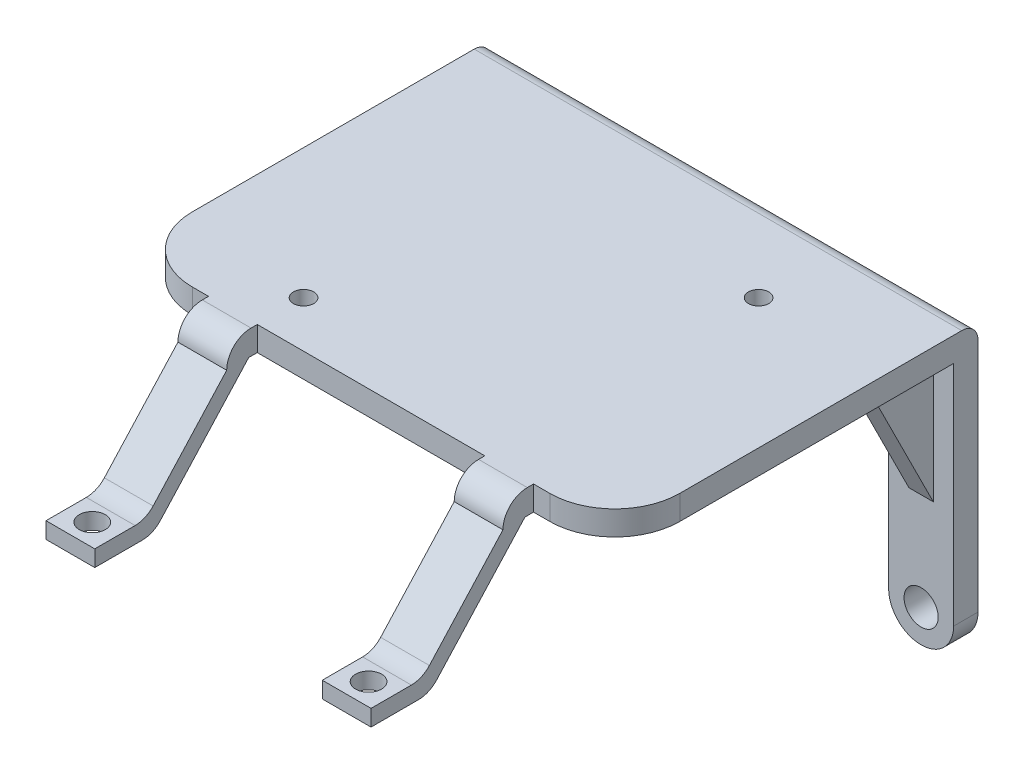
from build123d import *

# Parameters (mm, degrees)
SKETCH_1_W          = 60
SKETCH_1_H          = 50
EXTRUDE_1_DEPTH     = 3
SKETCH_2_R          = 1.25
CUT_EXTRUDE_1_DEPTH = 3
SKETCH_4_W          = 3
SKETCH_4_H          = 28
EXTRUDE_3_DEPTH     = 60
SKETCH_5_W          = 44
SKETCH_5_H          = 28
CUT_EXTRUDE_2_DEPTH = 10
EXTRUDE_4_DEPTH     = 3
SKETCH_8_R          = 2.1
CUT_EXTRUDE_3_DEPTH = 65.288412642
EXTRUDE_5_DEPTH     = 60
SKETCH_9_W          = 10
SKETCH_9_H          = 20
SKETCH_9_W_2        = 28
CUT_EXTRUDE_4_DEPTH = 54.293490307
SKETCH_11_R         = 1.6
CUT_EXTRUDE_5_DEPTH = 54.293490307
SKETCH_12_W         = 1.537741429
SKETCH_12_H         = 3
CUT_EXTRUDE_6_DEPTH = 72.413687212
FILLET_1_R          = 8
FILLET_2_R          = 8
FILLET_3_R          = 3
FILLET_4_R          = 3
FILLET_5_R          = 2
RIB_2_REACH         = 77.736
SKETCH_14_WALL_W    = 171.36018765
SKETCH_14_WALL_H    = 3
RIB_3_REACH         = 77.736
SKETCH_16_WALL_W    = 171.36018765
SKETCH_16_WALL_H    = 3
RIB_4_REACH         = 71.346
SKETCH_17_WALL_W    = 148.898052794
SKETCH_17_WALL_H    = 2
RIB_5_REACH         = 71.346
SKETCH_18_WALL_W    = 148.810340372
SKETCH_18_WALL_H    = 2


with BuildPart() as part:
    # 草图1 → 凸台-拉伸1 (new body)
    with BuildSketch(Plane(origin=(0, 0, 0), x_dir=(1, 0, 0), z_dir=(0, 1, 0))):
        Rectangle(SKETCH_1_W, SKETCH_1_H)
    extrude(amount=EXTRUDE_1_DEPTH)

    # 草图2 → 切除-拉伸1 (cut)
    with BuildSketch(Plane(origin=(0, 3, 0), x_dir=(1, 0, 0), z_dir=(0, 1, 0))):
        with Locations(Location((-14.000714267, -14.000714267, 0), (0, 0, 270))):
            Circle(SKETCH_2_R)
        with Locations(Location((14.000714267, 14.000714267, 0), (0, 0, 270))):
            Circle(SKETCH_2_R)
    extrude(amount=-CUT_EXTRUDE_1_DEPTH, mode=Mode.SUBTRACT)

    # 草图4 → 凸台-拉伸3 (add)
    with BuildSketch(Plane(origin=(30, 0, 0), x_dir=(0, 0, -1), z_dir=(1, 0, 0))):
        with Locations((23.5, -14)):
            Rectangle(SKETCH_4_W, SKETCH_4_H)
    extrude(amount=-EXTRUDE_3_DEPTH)

    # 草图5 → 切除-拉伸2 (cut)
    with BuildSketch(Plane(origin=(0, 0, -25), x_dir=(-1, 0, 0), z_dir=(0, 0, -1))):
        with Locations((0, -14)):
            Rectangle(SKETCH_5_W, SKETCH_5_H)
    extrude(amount=-CUT_EXTRUDE_2_DEPTH, mode=Mode.SUBTRACT)

    # 草图7 → 凸台-拉伸4 (add)
    with BuildSketch(Plane.XY.offset(-22)):
        with BuildLine():
            Line((-30, -28), (-22, -28))
            ThreePointArc((-22, -28), (-26, -32), (-30, -28))
        make_face()
        with BuildLine():
            Line((22, -28), (30, -28))
            ThreePointArc((30, -28), (26, -32), (22, -28))
        make_face()
    extrude(amount=-EXTRUDE_4_DEPTH)

    # 草图8 → 切除-拉伸3 (cut, through all)
    with BuildSketch(Plane.XY.offset(-22)):
        with Locations((26, -28)):
            Circle(SKETCH_8_R)
        with Locations((-26, -28)):
            Circle(SKETCH_8_R)
    extrude(amount=-CUT_EXTRUDE_3_DEPTH, mode=Mode.SUBTRACT)

    # 草图3 → 凸台-拉伸5 (add)
    with BuildSketch(Plane(origin=(30, 0, 0), x_dir=(0, 0, -1), z_dir=(1, 0, 0))):
        Polygon((-20.756443745, 0), (-32.524054991, -12.913843028), (-39.697792397, -12.913843028), (-39.697792397, -10.913843028), (-33.407389674, -10.913843028), (-23.462258571, 0), align=None)
    extrude(amount=-EXTRUDE_5_DEPTH)

    # 草图9 → 切除-拉伸4 (cut, through all)
    with BuildSketch(Plane.XZ.offset(12.913843028)):
        with Locations((25, 29.697792397)):
            Rectangle(SKETCH_9_W, SKETCH_9_H)
        with Locations((0, 29.697792397)):
            Rectangle(SKETCH_9_W_2, SKETCH_9_H)
        with Locations((-25, 29.697792397)):
            Rectangle(SKETCH_9_W, SKETCH_9_H)
    extrude(amount=-CUT_EXTRUDE_4_DEPTH, mode=Mode.SUBTRACT)

    # 草图11 → 切除-拉伸5 (cut, through all)
    with BuildSketch(Plane.XZ.offset(12.913843028)):
        with Locations(Location((17, 37, 0), (0, 0, 270))):
            Circle(SKETCH_11_R)
        with Locations(Location((-17, 37, 0), (0, 0, 270))):
            Circle(SKETCH_11_R)
    extrude(amount=-CUT_EXTRUDE_5_DEPTH, mode=Mode.SUBTRACT)

    # 草图12 → 切除-拉伸6 (cut, through all)
    with BuildSketch(Plane(origin=(20, 0, 0), x_dir=(0, 0, -1), z_dir=(1, 0, 0))):
        with Locations((-24.231129286, 1.5)):
            Rectangle(SKETCH_12_W, SKETCH_12_H)
    extrude(amount=-CUT_EXTRUDE_6_DEPTH, mode=Mode.SUBTRACT)

    # 圆角1
    fillet_1_edges = [part.edges().sort_by_distance(p)[0] for p in [
        (30, 1.5, 19.697792397),
    ]]
    fillet(fillet_1_edges, radius=FILLET_1_R)

    # 圆角2
    fillet_2_edges = [part.edges().sort_by_distance(p)[0] for p in [
        (-30, 1.5, 19.697792397),
    ]]
    fillet(fillet_2_edges, radius=FILLET_2_R)

    # 圆角3
    fillet_3_edges = [part.edges().sort_by_distance(p)[0] for p in [
        (17, 3, 23.462258571),
        (-17, 3, 23.462258571),
    ]]
    fillet(fillet_3_edges, radius=FILLET_3_R - 0.0001)  # a hair under: the kernel refuses the full size

    # 圆角4
    fillet_4_edges = [part.edges().sort_by_distance(p)[0] for p in [
        (-17, -10.913843028, 33.407389674),
        (17, -10.913843028, 33.407389674),
        (-17, -12.913843028, 32.524054991),
        (17, -12.913843028, 32.524054991),
    ]]
    fillet(fillet_4_edges, radius=FILLET_4_R)

    # 圆角5
    fillet_5_edges = [part.edges().sort_by_distance(p)[0] for p in [
        (0, 3, -25),
    ]]
    fillet(fillet_5_edges, radius=FILLET_5_R)

    # 草图14 wall → 筋2 (add, up to next)
    with BuildSketch(Plane(origin=(26, -8, -18), x_dir=(0, -0.894427191, -0.4472135955), z_dir=(0, 0.4472135955, -0.894427191)), mode=Mode.PRIVATE) as rib_2_sk1:
        Rectangle(SKETCH_14_WALL_W, SKETCH_14_WALL_H)
    rib_2_tool1 = extrude(rib_2_sk1.sketch, amount=RIB_2_REACH, mode=Mode.PRIVATE) - part.part
    add(rib_2_tool1.solids().sort_by_distance((26, -8, -18))[0])

    # 草图16 wall → 筋3 (add, up to next)
    with BuildSketch(Plane(origin=(-26, -8, -18), x_dir=(0, -0.894427191, -0.4472135955), z_dir=(0, -0.4472135955, 0.894427191)), mode=Mode.PRIVATE) as rib_3_sk1:
        Rectangle(SKETCH_16_WALL_W, SKETCH_16_WALL_H)
    rib_3_tool1 = extrude(rib_3_sk1.sketch, amount=-RIB_3_REACH, mode=Mode.PRIVATE) - part.part
    add(rib_3_tool1.solids().sort_by_distance((-26, -8, -18))[0])

    # 草图17 wall → 筋4 (add, up to next)
    with BuildSketch(Plane(origin=(17, -2.393367573, 21.786066703), x_dir=(0, 0.583365802334, -0.81220954234), z_dir=(0, 0.81220954234, 0.583365802334)), mode=Mode.PRIVATE) as rib_4_sk1:
        Rectangle(SKETCH_17_WALL_W, SKETCH_17_WALL_H)
    rib_4_tool1 = extrude(rib_4_sk1.sketch, amount=RIB_4_REACH, mode=Mode.PRIVATE) - part.part
    add(rib_4_tool1.solids().sort_by_distance((17, -2.393367573, 21.786066703))[0])

    # 草图18 wall → 筋5 (add, up to next)
    with BuildSketch(Plane(origin=(-17, -2.360222573, 21.75586365), x_dir=(0, -0.581503003153, 0.813544256525), z_dir=(0, 0.813544256525, 0.581503003153)), mode=Mode.PRIVATE) as rib_5_sk1:
        Rectangle(SKETCH_18_WALL_W, SKETCH_18_WALL_H)
    rib_5_tool1 = extrude(rib_5_sk1.sketch, amount=RIB_5_REACH, mode=Mode.PRIVATE) - part.part
    add(rib_5_tool1.solids().sort_by_distance((-17, -2.360222573, 21.75586365))[0])


solid = part.part
